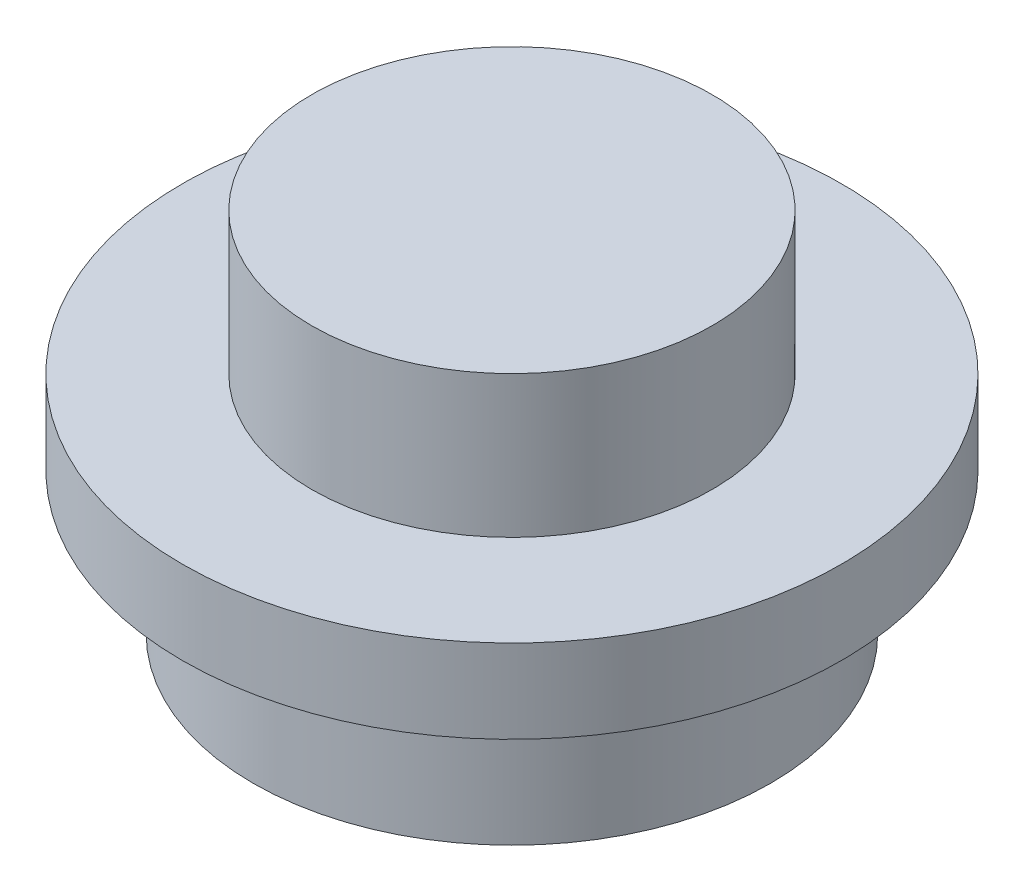
from build123d import *

# Parameters (mm, degrees)
SKETCH1_R           = 3.1
SKETCH1_R_2         = 2.4
BOSS_EXTRUDE1_DEPTH = 1.7
SKETCH2_R           = 3.95
BOSS_EXTRUDE2_DEPTH = 1
SKETCH3_R           = 2.4
BOSS_EXTRUDE3_DEPTH = 1.7


with BuildPart() as part:
    # Sketch1 → Boss-Extrude1 (new body)
    with BuildSketch(Plane(origin=(0, 0, 0), x_dir=(1, 0, 0), z_dir=(0, 1, 0))):
        Circle(SKETCH1_R)
        Circle(SKETCH1_R_2, mode=Mode.SUBTRACT)
    extrude(amount=BOSS_EXTRUDE1_DEPTH)

    # Sketch2 → Boss-Extrude2 (add)
    with BuildSketch(Plane(origin=(0, 1.7, 0), x_dir=(1, 0, 0), z_dir=(0, 1, 0))):
        Circle(SKETCH2_R)
    extrude(amount=BOSS_EXTRUDE2_DEPTH)

    # Sketch3 → Boss-Extrude3 (add)
    with BuildSketch(Plane(origin=(0, 2.7, 0), x_dir=(1, 0, 0), z_dir=(0, 1, 0))):
        Circle(SKETCH3_R)
    extrude(amount=BOSS_EXTRUDE3_DEPTH)


solid = part.part
